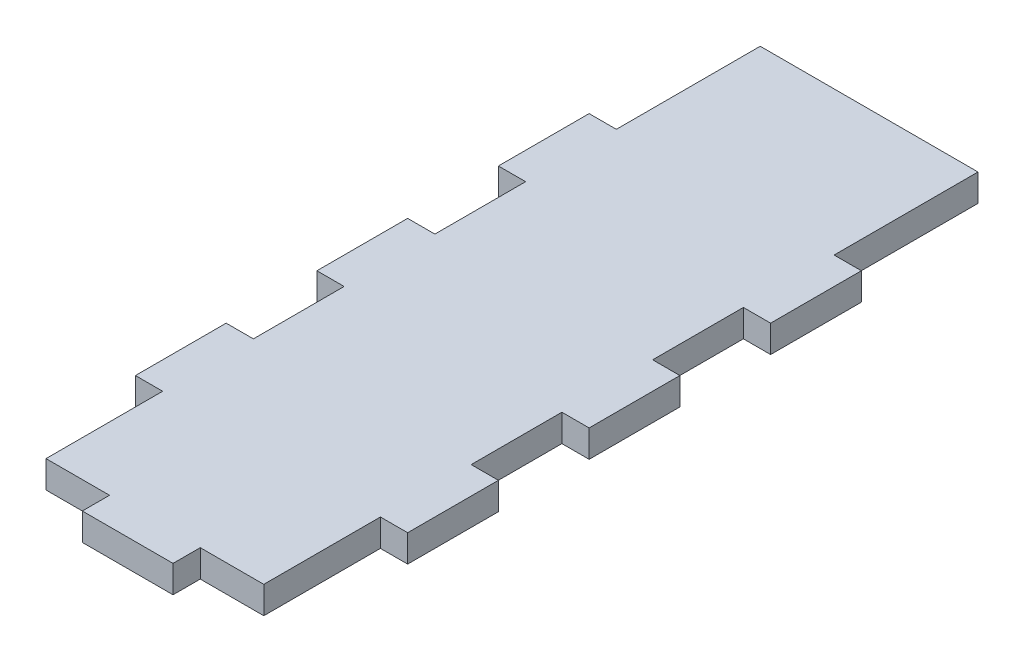
from build123d import *

# Parameters (mm, degrees)
SALIENTE_EXTRUIR1_DEPTH = 3


with BuildPart() as part:
    # Croquis1 → Saliente-Extruir1 (new body)
    with BuildSketch(Plane(origin=(0, 0, 0), x_dir=(1, 0, 0), z_dir=(0, 1, 0))):
        Polygon((0, 25.855), (0, 15.855), (3, 15.855), (3, 3), (10, 3), (10, 0), (20, 0), (20, 3), (27, 3), (27, 15.855), (30, 15.855), (30, 25.855), (27, 25.855), (27, 35.855), (30, 35.855), (30, 45.855), (27, 45.855), (27, 55.855), (30, 55.855), (30, 65.855), (27, 65.855), (27, 81.71), (3, 81.71), (3, 65.855), (0, 65.855), (0, 55.855), (3, 55.855), (3, 45.855), (0, 45.855), (0, 40.855), (0, 35.855), (3, 35.855), (3, 25.855), align=None)
    extrude(amount=SALIENTE_EXTRUIR1_DEPTH)


solid = part.part
